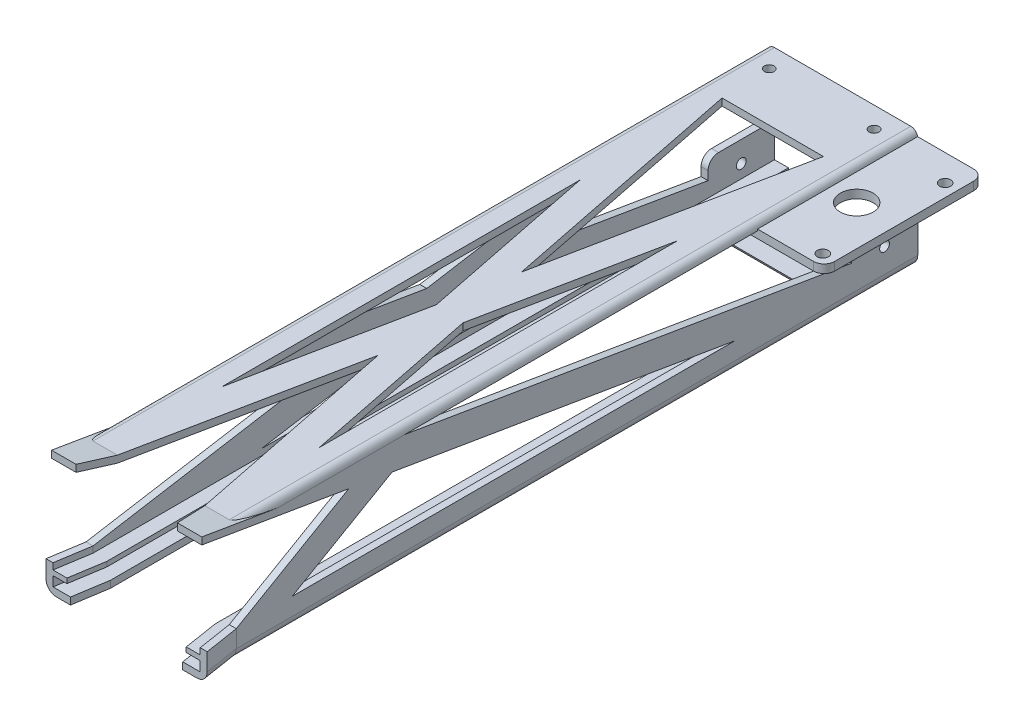
from build123d import *

# Parameters (mm, degrees)
SKETCH1_W                                 = 4
SKETCH1_H                                 = 1.4
SKETCH1_W_2                               = 39
SKETCH1_H_2                               = 2
SKETCH1_W_3                               = 2
SKETCH1_H_3                               = 27.8
SKETCH1_W_4                               = 19.5
BOSS_EXTRUDE1_DEPTH                       = 195
CUT_EXTRUDE1_DEPTH                        = 203.393181703
CUT_EXTRUDE1_DEPTH_BACK                   = 203.393181703
SKETCH2_W                                 = 191
SKETCH2_H                                 = 24
SKETCH3_W                                 = 29
SKETCH3_H                                 = 223
CUT_EXTRUDE2_DEPTH                        = 2
SKETCH5_W                                 = 45.8
SKETCH5_H                                 = 4
BOSS_EXTRUDE2_DEPTH                       = 2
SKETCH8_W                                 = 15
SKETCH8_H                                 = 8
BOSS_EXTRUDE4_DEPTH                       = 2
SKETCH9_W                                 = 15
SKETCH9_H                                 = 8
BOSS_EXTRUDE5_DEPTH                       = 2
BOSS_EXTRUDE6_DEPTH                       = 2
SKETCH6_W                                 = 45.8
SKETCH6_H                                 = 2.4
BOSS_EXTRUDE9_DEPTH                       = 19
SKETCH14_R                                = 4.7
SKETCH14_R_2                              = 1.6
CUT_EXTRUDE3_DEPTH                        = 19
TAP_DRILL_FOR_M3X0_5_TAP1_D               = 2.8
TAP_DRILL_FOR_M3X0_5_TAP1_DEPTH           = 10
TAP_DRILL_FOR_M3X0_5_TAP1_TIP             = 0.841204867
TAP_DRILL_FOR_M3X0_5_TAP1_ON_FACE_2_D     = 2.8
TAP_DRILL_FOR_M3X0_5_TAP1_ON_FACE_2_DEPTH = 10
TAP_DRILL_FOR_M3X0_5_TAP1_ON_FACE_2_TIP   = 0.841204867
TAP_DRILL_FOR_M3X0_5_TAP2_D               = 2.8
TAP_DRILL_FOR_M3X0_5_TAP2_DEPTH           = 10
TAP_DRILL_FOR_M3X0_5_TAP2_TIP             = 0.841204867
BOSS_EXTRUDE10_DEPTH                      = 2
BOSS_EXTRUDE11_START                      = -21.5
BOSS_EXTRUDE11_DEPTH                      = 43
BOSS_EXTRUDE12_DEPTH                      = 3
BOSS_EXTRUDE12_DEPTH_BACK                 = 1
SKETCH23_W                                = 36
SKETCH23_H                                = 20
FILLET3_R                                 = 3
FILLET4_R                                 = 3
FILLET5_R                                 = 3
FILLET6_R                                 = 3
CHAMFER3_SIZE                             = 8
CHAMFER3_SIZE_2                           = 1.410615846
BOSS_EXTRUDE14_DEPTH                      = 10
BOSS_EXTRUDE15_DEPTH                      = 10
FILLET7_R                                 = 2
CUT_EXTRUDE6_DEPTH                        = 10
CUT_EXTRUDE6_DEPTH_BACK                   = 10
SKETCH28_W                                = 29
SKETCH28_H                                = 20
CUT_EXTRUDE7_DEPTH                        = 2


# Read off the part's stored shape, not the designer's step: Boss-Extrude11
# Some blends are built 0.0001 mm under size
with BuildPart() as part:
    # Sketch1 → Boss-Extrude1 (new body)
    with BuildSketch(Plane.XY):
        Polygon((19.5, 1), (19.5, -1), (21.5, -1), (21.5, 5.2), (19.5, 5.2), (19.5, 3.8), align=None)
        with Locations((17.5, 4.5)):
            Rectangle(SKETCH1_W, SKETCH1_H)
        Rectangle(SKETCH1_W_2, SKETCH1_H_2)
        Polygon((-21.5, -1), (-19.5, -1), (-19.5, 1), (-19.5, 3.8), (-19.5, 5.2), (-21.5, 5.2), align=None)
        with Locations((-17.5, 4.5)):
            Rectangle(SKETCH1_W, SKETCH1_H)
        with Locations((20.5, 19.1)):
            Rectangle(SKETCH1_W_3, SKETCH1_H_3)
        with Locations((9.75, 32)):
            Rectangle(SKETCH1_W_4, SKETCH1_H_2)
        with Locations((-9.75, 32)):
            Rectangle(SKETCH1_W_4, SKETCH1_H_2)
        Polygon((-21.5, 33), (-21.5, 5.2), (-19.5, 5.2), (-19.5, 31), (-19.5, 33), align=None)
    extrude(amount=BOSS_EXTRUDE1_DEPTH)

    # Sketch2 → Cut-Extrude1 (cut, two sides: drawn at the far end of the back side and taken through both)
    with BuildSketch(Plane(origin=(21.5, 0, 0), x_dir=(0, 0, -1), z_dir=(1, 0, 0)).offset(-CUT_EXTRUDE1_DEPTH_BACK)):
        with Locations((-99.5, 19)):
            Rectangle(SKETCH2_W, SKETCH2_H)
    extrude(amount=CUT_EXTRUDE1_DEPTH + CUT_EXTRUDE1_DEPTH_BACK, mode=Mode.SUBTRACT)

    # Sketch3 → Cut-Extrude2 (cut)
    with BuildSketch(Plane(origin=(0, -1, 0), x_dir=(-1, 0, 0), z_dir=(0, -1, 0))):
        with Locations((0, -103.5)):
            Rectangle(SKETCH3_W, SKETCH3_H)
    extrude(amount=-CUT_EXTRUDE2_DEPTH, mode=Mode.SUBTRACT)

    # Sketch5 → Boss-Extrude2 (add)
    with BuildSketch(Plane(origin=(21.5, 0, 0), x_dir=(0, 0, -1), z_dir=(1, 0, 0))):
        with Locations((-22.9, 31)):
            Rectangle(SKETCH5_W, SKETCH5_H)
    extrude(amount=-BOSS_EXTRUDE2_DEPTH)

    # Sketch8 → Boss-Extrude4 (add)
    with BuildSketch(Plane(origin=(21.5, 0, 0), x_dir=(0, 0, -1), z_dir=(1, 0, 0))):
        with Locations((-11.5, 11)):
            Rectangle(SKETCH8_W, SKETCH8_H)
    extrude(amount=-BOSS_EXTRUDE4_DEPTH)

    # Sketch9 → Boss-Extrude5 (add)
    with BuildSketch(Plane.ZY.offset(21.5)):
        with Locations((11.5, 11)):
            Rectangle(SKETCH9_W, SKETCH9_H)
    extrude(amount=-BOSS_EXTRUDE5_DEPTH)

    # Sketch10 → Boss-Extrude6 (add)
    with BuildSketch(Plane.ZY.offset(21.5)):
        Polygon((4, 31), (146.749133454, 7), (195, 7), (52.250866546, 31), align=None)
        Polygon((195, 31), (52.250866546, 7), (4, 7), (146.749133454, 31), align=None)
    extrude(amount=-BOSS_EXTRUDE6_DEPTH)

    # Sketch6 → Boss-Extrude9 (add)
    with BuildSketch(Plane(origin=(21.5, 0, 0), x_dir=(0, 0, -1), z_dir=(1, 0, 0))):
        with Locations((-22.9, 30.2)):
            Rectangle(SKETCH6_W, SKETCH6_H)
    extrude(amount=BOSS_EXTRUDE9_DEPTH)

    # Sketch14 → Cut-Extrude3 (cut)
    with BuildSketch(Plane(origin=(0, 29, 0), x_dir=(-1, 0, 0), z_dir=(0, -1, 0))):
        with Locations(Location((-29.082681436, -25.05, 0), (0, 0, 90))):
            Circle(SKETCH14_R)
        with Locations(Location((-36.882681436, -42.55, 0), (0, 0, 90))):
            Circle(SKETCH14_R_2)
        with Locations(Location((-36.882681436, -7.55, 0), (0, 0, 90))):
            Circle(SKETCH14_R_2)
    extrude(amount=-CUT_EXTRUDE3_DEPTH, mode=Mode.SUBTRACT)

    # Tap Drill for M3x0.5 Tap1
    with Locations(Plane(origin=(-21.5, 9, 9.5), x_dir=(0, 0, -1), z_dir=(-1, 0, 0))):
        with Locations((0, 0)):
            Hole(TAP_DRILL_FOR_M3X0_5_TAP1_D / 2, depth=TAP_DRILL_FOR_M3X0_5_TAP1_DEPTH)
            with Locations((0, 0, -(TAP_DRILL_FOR_M3X0_5_TAP1_DEPTH + TAP_DRILL_FOR_M3X0_5_TAP1_TIP / 2))):  # 118° drill point
                Cone(0, TAP_DRILL_FOR_M3X0_5_TAP1_D / 2, TAP_DRILL_FOR_M3X0_5_TAP1_TIP, mode=Mode.SUBTRACT)

    # Tap Drill for M3x0.5 Tap1 on face 2
    with Locations(Plane(origin=(21.5, 9, 9.5), x_dir=(0, 0, 1), z_dir=(1, 0, 0))):
        with Locations((0, 0)):
            Hole(TAP_DRILL_FOR_M3X0_5_TAP1_ON_FACE_2_D / 2, depth=TAP_DRILL_FOR_M3X0_5_TAP1_ON_FACE_2_DEPTH)
            with Locations((0, 0, -(TAP_DRILL_FOR_M3X0_5_TAP1_ON_FACE_2_DEPTH + TAP_DRILL_FOR_M3X0_5_TAP1_ON_FACE_2_TIP / 2))):  # 118° drill point
                Cone(0, TAP_DRILL_FOR_M3X0_5_TAP1_ON_FACE_2_D / 2, TAP_DRILL_FOR_M3X0_5_TAP1_ON_FACE_2_TIP, mode=Mode.SUBTRACT)

    # Tap Drill for M3x0.5 Tap2
    with Locations(Plane(origin=(15, 33, 6), x_dir=(0, 0, 1), z_dir=(0, 1, 0))):
        with Locations((0, 0), (0, -30)):
            Hole(TAP_DRILL_FOR_M3X0_5_TAP2_D / 2, depth=TAP_DRILL_FOR_M3X0_5_TAP2_DEPTH)
            with Locations((0, 0, -(TAP_DRILL_FOR_M3X0_5_TAP2_DEPTH + TAP_DRILL_FOR_M3X0_5_TAP2_TIP / 2))):  # 118° drill point
                Cone(0, TAP_DRILL_FOR_M3X0_5_TAP2_D / 2, TAP_DRILL_FOR_M3X0_5_TAP2_TIP, mode=Mode.SUBTRACT)

    # Sketch13 → Boss-Extrude10 (add)
    with BuildSketch(Plane(origin=(21.5, 0, 0), x_dir=(0, 0, -1), z_dir=(1, 0, 0))):
        Polygon((-150.414335828, 23.503940905), (-162.805864398, 25.587292856), (-195, 7), (-179, 7), align=None)
        Polygon((-146.749133454, 31), (-195, 31), (-162.805864398, 25.587292856), (-146.805864398, 25.587292856), (-150.414335828, 23.503940905), (-52.250866546, 7), (-19, 7), (-19, 9.521906727), align=None)
        Polygon((-146.805864398, 25.587292856), (-162.805864398, 25.587292856), (-150.414335828, 23.503940905), align=None)
    extrude(amount=-BOSS_EXTRUDE10_DEPTH)

    # Boss-Extrude11 outline → Boss-Extrude11 (add)
    with BuildSketch(Plane.YZ.offset(BOSS_EXTRUDE11_START)):
        Polygon((32.658001311, 204.861593768), (31, 195), (33, 195), (34.658001311, 204.861593768), align=None)
    extrude(amount=BOSS_EXTRUDE11_DEPTH)

    # Sketch23 → Boss-Extrude12 (add, two sides: drawn at the far end of the back side and taken through both)
    with BuildSketch(Plane(origin=(0, -1, 0), x_dir=(-1, 0, 0), z_dir=(0, -1, 0)).offset(-BOSS_EXTRUDE12_DEPTH_BACK)):
        with Locations((0, -10)):
            Rectangle(SKETCH23_W, SKETCH23_H)
    extrude(amount=BOSS_EXTRUDE12_DEPTH + BOSS_EXTRUDE12_DEPTH_BACK)

    # Fillet3
    fillet3_edges = [part.edges().sort_by_distance(p)[0] for p in [
        (18, -4, 10),
        (0, -4, 20),
        (-18, -4, 10),
    ]]
    fillet(fillet3_edges, radius=FILLET3_R - 0.0001)  # a hair under: the kernel refuses the full size

    # Fillet4
    fillet4_edges = [part.edges().sort_by_distance(p)[0] for p in [
        (21.5, -1, 97.5),
        (-21.5, -1, 97.5),
    ]]
    fillet(fillet4_edges, radius=FILLET4_R)

    # Fillet5
    fillet5_edges = [part.edges().sort_by_distance(p)[0] for p in [
        (20.5, 15, 19),
        (-20.5, 15, 19),
    ]]
    fillet(fillet5_edges, radius=FILLET5_R)

    # Fillet6
    fillet6_edges = [part.edges().sort_by_distance(p)[0] for p in [
        (40.5, 30.2, 45.8),
        (40.5, 30.2, 0),
    ]]
    fillet(fillet6_edges, radius=FILLET6_R)

    # Chamfer3
    # the kernel refuses this chamfer: 8, 1.410615846 mm, written as the material it takes off along each edge
    with BuildSketch(Plane(origin=(14.5, 0, 20), x_dir=(0, 0.0066825316561017496, -0.9999776716360547), z_dir=(-1, 0, 0))) as chamfer3_piece_1:
        Polygon((CHAMFER3_SIZE * 0.999977671636, CHAMFER3_SIZE * 0.0066825316561), (-CHAMFER3_SIZE_2 * 0.00668253165453, CHAMFER3_SIZE_2 * 0.999977671401), (0, 0), align=None)
    extrude(amount=29, mode=Mode.SUBTRACT)

    # Sketch24 → Boss-Extrude14 (add, along a direction that is not the sketch's normal)
    with BuildSketch(Plane.XY.offset(195)):
        with BuildLine():
            Line((-21.5, 7), (-21.5, 2))
            ThreePointArc((-21.5, 2), (-20.621320344, -0.121320344), (-18.5, -1))
            Line((-18.5, -1), (-14.5, -1))
            Line((-14.5, -1), (-14.5, 1))
            Line((-14.5, 1), (-19.5, 1))
            Line((-19.5, 1), (-19.5, 3.8))
            Line((-19.5, 3.8), (-15.5, 3.8))
            Line((-15.5, 3.8), (-15.5, 5.2))
            Line((-15.5, 5.2), (-19.5, 5.2))
            Line((-19.5, 5.2), (-19.5, 7))
            Line((-19.5, 7), (-21.5, 7))
        make_face()
    extrude(amount=BOSS_EXTRUDE14_DEPTH, dir=(-0.15643446504023106, 0, 0.9876883405951378))

    # Sketch26 → Boss-Extrude15 (add, along a direction that is not the sketch's normal)
    with BuildSketch(Plane.XY.offset(195)):
        with BuildLine():
            Line((14.5, -1), (18.5, -1))
            ThreePointArc((18.5, -1), (20.621320344, -0.121320344), (21.5, 2))
            Line((21.5, 2), (21.5, 7))
            Line((21.5, 7), (19.5, 7))
            Line((19.5, 7), (19.5, 5.2))
            Line((19.5, 5.2), (15.5, 5.2))
            Line((15.5, 5.2), (15.5, 3.8))
            Line((15.5, 3.8), (19.5, 3.8))
            Line((19.5, 3.8), (19.5, 1))
            Line((19.5, 1), (14.5, 1))
            Line((14.5, 1), (14.5, -1))
        make_face()
    extrude(amount=BOSS_EXTRUDE15_DEPTH, dir=(0.15643446504022418, 0, 0.9876883405951389))

    # Fillet7
    fillet7_edges = [part.edges().sort_by_distance(p)[0] for p in [
        (21.5, 33, 97.5),
        (-21.5, 33, 97.5),
    ]]
    fillet(fillet7_edges, radius=FILLET7_R - 0.0001)  # a hair under: the kernel refuses the full size

    # Sketch27 → Cut-Extrude6 (cut, two sides: drawn at the far end of the back side and taken through both)
    with BuildSketch(Plane(origin=(0, 33, 0), x_dir=(1, 0, 0), z_dir=(0, 1, 0)).offset(-CUT_EXTRUDE6_DEPTH_BACK)):
        Polygon((4.150405868, -112.780977824), (14.5, -164.267549777), (14.5, -61.683054851), align=None)
        Polygon((-14.5, -163.178538917), (-4.150405868, -112.080615944), (-14.5, -60.594043992), align=None)
        Polygon((-12.502590183, -195), (12.517667731, -195), (0.054934327, -133.001103045), align=None)
        Polygon((-8.142372311, -204.861593768), (14.5, -204.861593768), (12.517667731, -195), (-12.502590183, -195), (-14.5, -204.861593768), align=None)
        Polygon((-14.5, -20), (-0.054934327, -91.860490724), (14.5, -20), align=None)
    extrude(amount=CUT_EXTRUDE6_DEPTH + CUT_EXTRUDE6_DEPTH_BACK, mode=Mode.SUBTRACT)

    # Sketch28 → Cut-Extrude7 (cut)
    with BuildSketch(Plane(origin=(0, 0, 0), x_dir=(1, 0, 0), z_dir=(0, 1, 0))):
        with Locations((0, -10)):
            Rectangle(SKETCH28_W, SKETCH28_H)
    extrude(amount=-CUT_EXTRUDE7_DEPTH, mode=Mode.SUBTRACT)


solid = part.part
